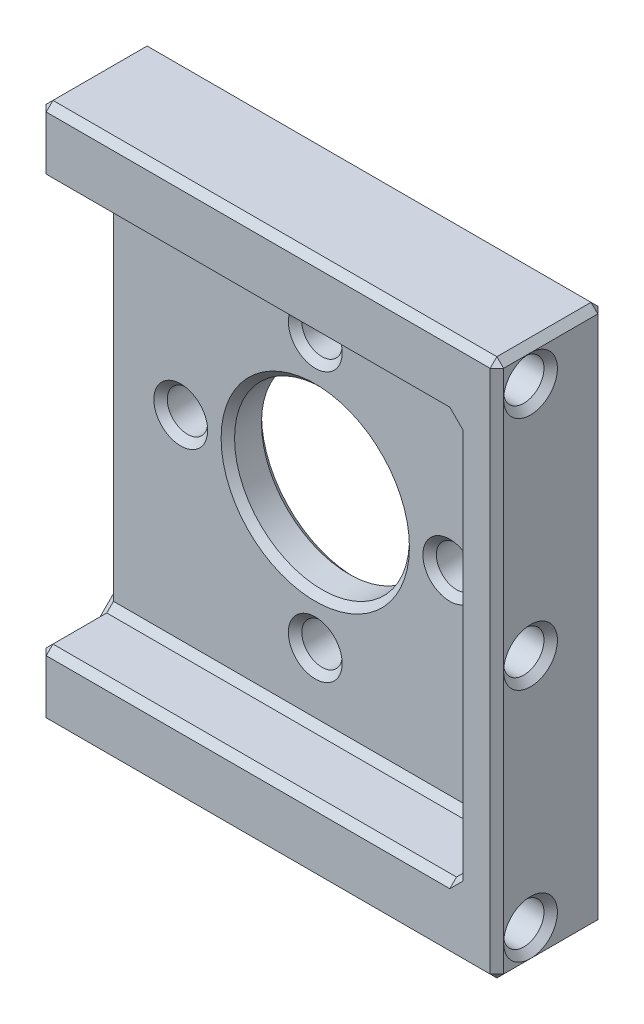
from build123d import *

# Parameters (mm, degrees)
ESQUISSE1_W             = 34
ESQUISSE1_H             = 40
BOSS_EXTRU_1_DEPTH      = 3
ESQUISSE2_R             = 6.5
ENL_V_MAT_EXTRU_1_DEPTH = 4
ESQUISSE5_R             = 1.5
ENL_V_MAT_EXTRU_3_DEPTH = 5
ESQUISSE9_W             = 34
ESQUISSE9_H             = 5
BOSS_EXTRU_5_DEPTH      = 5
ESQUISSE10_R            = 1.5
ENL_V_MAT_EXTRU_6_DEPTH = 54.103672189
ESQUISSE11_W            = 3
ESQUISSE11_H            = 30
BOSS_EXTRU_6_DEPTH      = 5
ESQUISSE12_R            = 1.5
ENL_V_MAT_EXTRU_7_DEPTH = 5
CHANFREIN1_SIZE         = 0.5


with BuildPart() as part:
    # Esquisse1 → Boss.-Extru.1 (new body)
    with BuildSketch(Plane.XY):
        with Locations((17, 20)):
            Rectangle(ESQUISSE1_W, ESQUISSE1_H)
    extrude(amount=BOSS_EXTRU_1_DEPTH)

    # Esquisse2 → Enlèv. mat.-Extru.1 (cut)
    with BuildSketch(Plane.XY.offset(3)):
        with Locations((15.5, 20)):
            Circle(ESQUISSE2_R)
    extrude(amount=-ENL_V_MAT_EXTRU_1_DEPTH, mode=Mode.SUBTRACT)

    # Esquisse5 → Enlèv. mat.-Extru.3 (cut)
    with BuildSketch(Plane.XY.offset(3)):
        with Locations((15.5, 30)):
            Circle(ESQUISSE5_R)
        with Locations((5.5, 20)):
            Circle(ESQUISSE5_R)
        with Locations((15.5, 10)):
            Circle(ESQUISSE5_R)
        with Locations((25.5, 20)):
            Circle(ESQUISSE5_R)
    extrude(amount=-ENL_V_MAT_EXTRU_3_DEPTH, mode=Mode.SUBTRACT)

    # Esquisse9 → Boss.-Extru.5 (add)
    with BuildSketch(Plane.XY.offset(3)):
        with Locations((17, 37.5)):
            Rectangle(ESQUISSE9_W, ESQUISSE9_H)
        with Locations((17, 2.5)):
            Rectangle(ESQUISSE9_W, ESQUISSE9_H)
    extrude(amount=BOSS_EXTRU_5_DEPTH)

    # Esquisse10 → Enlèv. mat.-Extru.6 (cut, through all)
    with BuildSketch(Plane(origin=(34, 0, 0), x_dir=(0, 0, -1), z_dir=(1, 0, 0))):
        with Locations((-5.5, 37.5)):
            Circle(ESQUISSE10_R)
        with Locations(Location((-5.5, 2.5, 0), (0, 0, 180))):
            Circle(ESQUISSE10_R)
    extrude(amount=-ENL_V_MAT_EXTRU_6_DEPTH, mode=Mode.SUBTRACT)

    # Esquisse11 → Boss.-Extru.6 (add)
    with BuildSketch(Plane.XY.offset(3)):
        with Locations((32.5, 20)):
            Rectangle(ESQUISSE11_W, ESQUISSE11_H)
    extrude(amount=BOSS_EXTRU_6_DEPTH)

    # Esquisse12 → Enlèv. mat.-Extru.7 (cut)
    with BuildSketch(Plane(origin=(34, 0, 0), x_dir=(0, 0, -1), z_dir=(1, 0, 0))):
        with Locations((-5.5, 20)):
            Circle(ESQUISSE12_R)
    extrude(amount=-ENL_V_MAT_EXTRU_7_DEPTH, mode=Mode.SUBTRACT)

    # Chanfrein1
    chanfrein1_edges = [part.edges().sort_by_distance(p)[0] for p in [
        (9, 20, 0),
        (9, 20, 3),
        (14, 30, 0),
        (14, 30, 3),
        (4, 20, 0),
        (4, 20, 3),
        (14, 10, 0),
        (14, 10, 3),
        (24, 20, 0),
        (24, 20, 3),
        (0, 20, 3),
        (15.5, 35, 3),
        (0, 35, 5.5),
        (0, 37.5, 8),
        (15.5, 35, 8),
        (34, 20, 8),
        (17, 40, 8),
        (17, 40, 0),
        (34, 20, 0),
        (0, 5, 5.5),
        (17, 0, 0),
        (0, 2.5, 8),
        (17, 0, 8),
        (0, 20, 0),
        (0, 37.5, 7),
        (34, 37.5, 7),
        (0, 2.5, 4),
        (34, 2.5, 4),
        (0, 40, 4),
        (15.5, 5, 8),
        (15.5, 5, 3),
        (34, 40, 4),
        (34, 0, 4),
        (0, 0, 4),
        (31, 20, 3),
        (31, 35, 5.5),
        (31, 5, 5.5),
        (31, 20, 8),
        (31, 20, 7),
        (34, 20, 7),
    ]]
    chamfer(chanfrein1_edges, length=CHANFREIN1_SIZE - 0.0001)  # a hair under: the kernel refuses the full size


solid = part.part
